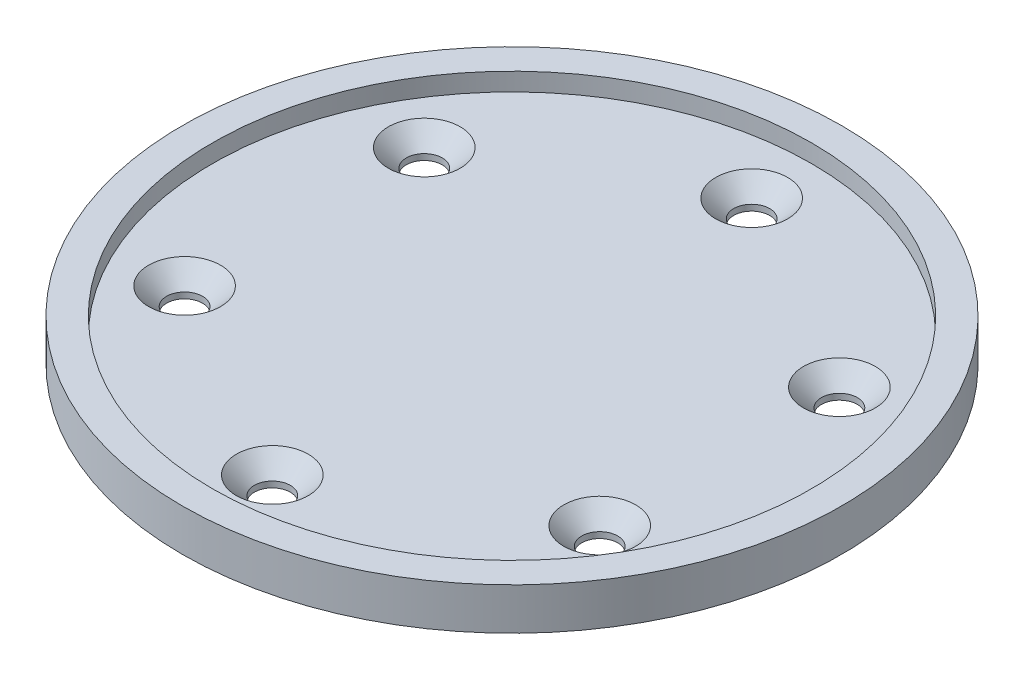
from build123d import *

# Parameters (mm, degrees)
SKETCH2_R          = 3
CUT_EXTRUDE1_DEPTH = 78.884529914
CHAMFER1_SIZE      = 3


with BuildPart() as part:
    # Sketch1 → Revolve1 (revolve)
    with BuildSketch(Plane.XY):
        Polygon((50, 3.478641915), (50, 6.478641915), (55, 6.478641915), (55, -0.521358085), (0, -0.521358085), (0, 3.478641915), align=None)
    revolve(axis=Axis((0, 0, 0), (0, 1, 0)))

    # Sketch2 → Cut-Extrude1 (cut, through all)
    with BuildSketch(Plane(origin=(0, 3.478641915, 0), x_dir=(1, 0, 0), z_dir=(0, 1, 0))):
        with Locations((0, 40)):
            Circle(SKETCH2_R)
        with Locations((34.641016151, 20)):
            Circle(SKETCH2_R)
        with Locations((34.641016151, -20)):
            Circle(SKETCH2_R)
        with Locations((0, -40)):
            Circle(SKETCH2_R)
        with Locations((-34.641016151, -20)):
            Circle(SKETCH2_R)
        with Locations((-34.641016151, 20)):
            Circle(SKETCH2_R)
    extrude(amount=-CUT_EXTRUDE1_DEPTH, mode=Mode.SUBTRACT)

    # Chamfer1
    chamfer1_edges = [part.edges().sort_by_distance(p)[0] for p in [
        (-3, 3.478641915, -40),
        (31.641016151, 3.478641915, -20),
        (31.641016151, 3.478641915, 20),
        (-3, 3.478641915, 40),
        (-37.641016151, 3.478641915, 20),
        (-37.641016151, 3.478641915, -20),
    ]]
    chamfer(chamfer1_edges, length=CHAMFER1_SIZE)


solid = part.part
